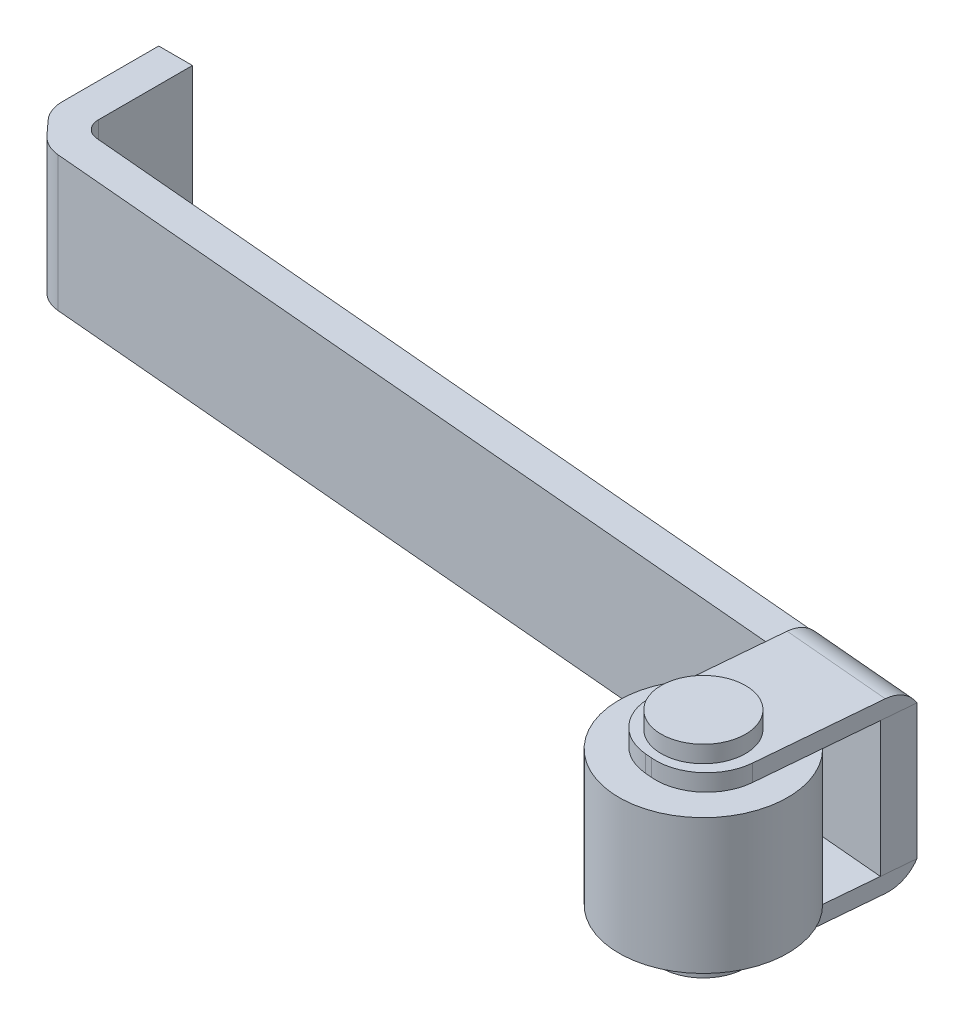
from build123d import *

# Parameters (mm, degrees)
SKETCH1_W                  = 1
SKETCH1_H                  = 4
BOSS_EXTRUDE1_DEPTH        = 4.25
CHAMFER1_SIZE              = 1
CHAMFER1_SIZE2             = 0.087488664
SKETCH2_W                  = 1.003819838
SKETCH2_H                  = 4
BOSS_EXTRUDE2_DEPTH        = 27.2
CHAMFER2_START             = -4
CHAMFER2_OUTLINE_W         = 4
CHAMFER2_OUTLINE_H         = 7
CHAMFER2_DEPTH             = 1.801741323
FILLET2_R                  = 0.5
FILLET3_R                  = 1
BOSS_EXTRUDE3_DEPTH        = 5
BOSS_EXTRUDE3_DEPTH_BACK   = 1
SKETCH3_W                  = 3.2
SKETCH3_H                  = 0.5
BOSS_EXTRUDE3_2_DEPTH      = 5
BOSS_EXTRUDE3_2_DEPTH_BACK = 1
FILLET5_R                  = 1
FILLET6_R                  = 1
FILLET9_R                  = 1.5
FILLET10_R                 = 1.5
BOSS_EXTRUDE4_DEPTH        = 0.5
BOSS_EXTRUDE4_DEPTH_BACK   = 5.5
SKETCH5_R                  = 1.25
SKETCH6_R                  = 2.5
BOSS_EXTRUDE5_DEPTH        = 4


with BuildPart() as part:
    # Sketch1 → Boss-Extrude1 (new body)
    with BuildSketch(Plane.XY):
        with Locations((0.5, 4.75)):
            Rectangle(SKETCH1_W, SKETCH1_H)
    extrude(amount=BOSS_EXTRUDE1_DEPTH)

    # Chamfer1
    chamfer1_edges = [part.edges().sort_by_distance(p)[0] for p in [
        (1, 4.75, 4.25),
    ]]
    chamfer1_side = [part.faces().sort_by_distance(p)[0] for p in [
        (1, 4.75, 2.125),
    ]]
    chamfer(chamfer1_edges, length=CHAMFER1_SIZE, length2=CHAMFER1_SIZE2, reference=chamfer1_side[0])

    # Sketch2 → Boss-Extrude2 (add)
    with BuildSketch(Plane(origin=(1.274582165, 0, 0.11151149), x_dir=(0.08715574274765592, 0, -0.9961946980917458), z_dir=(0.9961946980917459, 0, 0.08715574274765593))):
        with Locations((-3.652386945, 4.75)):
            Rectangle(SKETCH2_W, SKETCH2_H)
    extrude(amount=BOSS_EXTRUDE2_DEPTH)

    # Chamfer2: read off the stored shape, not the designer's step
    # Chamfer2 outline → Chamfer2 (cut)
    with BuildSketch(Plane(origin=(0, 0, 0), x_dir=(0.6755902076156571, 0, 0.737277336810127), z_dir=(0.737277336810127, 0, -0.675590207615657)).offset(CHAMFER2_START)):
        with Locations((3, -4.5)):
            Rectangle(CHAMFER2_OUTLINE_W, CHAMFER2_OUTLINE_H)
    extrude(amount=CHAMFER2_DEPTH, mode=Mode.SUBTRACT)

    # Fillet2
    fillet2_edges = [part.edges().sort_by_distance(p)[0] for p in [
        (1, 4.75, 3.25),
    ]]
    fillet(fillet2_edges, radius=FILLET2_R)

    # Fillet3
    fillet3_edges = [part.edges().sort_by_distance(p)[0] for p in [
        (0, 4.75, 3.253834428),
        (0.912844258, 4.75, 4.250029127),
    ]]
    fillet(fillet3_edges, radius=FILLET3_R)


with BuildPart() as body_2:
    # Sketch3 → Boss-Extrude3 (new, two sides: drawn at the far end of the back side and taken through both)
    with BuildSketch(Plane(origin=(-0.362070829, 0, 4.13848851), x_dir=(0.9961946980917458, 0, 0.08715574274765595), z_dir=(-0.08715574274765596, 0, 0.9961946980917459)).offset(-BOSS_EXTRUDE3_DEPTH_BACK)):
        with Locations((26.879450862, 7)):
            Rectangle(SKETCH3_W, SKETCH3_H)
    extrude(amount=BOSS_EXTRUDE3_DEPTH + BOSS_EXTRUDE3_DEPTH_BACK)

    # Fillet5
    # the kernel refuses this fillet: 1 mm, written as the material it takes off along each edge
    with BuildSketch(Plane(origin=(22.751515044, 7.25, 5.15684541), x_dir=(-0.08715574274765596, 0, 0.9961946980917458), z_dir=(0.9961946980917459, 0, 0.08715574274765596))) as fillet5_piece_1:
        with BuildLine():
            CenterArc((0.866025404, 1), FILLET5_R, 210, 60)
            Line((0, 0.5), (-0.017320508, 0.49))
            ThreePointArc((-0.017320508, 0.49), (-0.02, 0.25), (-0.02, 0))
            Line((-0.02, 0), (0, -0.02))
            Line((0, -0.02), (0.866025404, -0.02))
            Line((0.866025404, -0.02), (0.866025404, 0))
        make_face()
    extrude(amount=7.530127019, mode=Mode.SUBTRACT)

    # Fillet10
    fillet10_edges = [body_2.edges().sort_by_distance(p)[0] for p in [
        (27.573228411, 7, 11.601609693),
        (24.385405377, 7, 11.322711316),
    ]]
    fillet(fillet10_edges, radius=FILLET10_R)



with BuildPart() as body_3:
    # Sketch3 → Boss-Extrude3 2 (new, two sides: drawn at the far end of the back side and taken through both)
    with BuildSketch(Plane(origin=(-0.362070829, 0, 4.13848851), x_dir=(0.9961946980917458, 0, 0.08715574274765595), z_dir=(-0.08715574274765596, 0, 0.9961946980917459)).offset(-BOSS_EXTRUDE3_2_DEPTH_BACK)):
        with Locations((26.879450862, 2.5)):
            Rectangle(SKETCH3_W, SKETCH3_H)
    extrude(amount=BOSS_EXTRUDE3_2_DEPTH + BOSS_EXTRUDE3_2_DEPTH_BACK)

    # Fillet6
    # the kernel refuses this fillet: 1 mm, written as the material it takes off along each edge
    with BuildSketch(Plane(origin=(22.751515044, 2.25, 5.15684541), x_dir=(0, 1, 0), z_dir=(0.9961946980917459, 0, 0.08715574274765596))) as fillet6_piece_1:
        with BuildLine():
            CenterArc((1, 0.866025404), FILLET6_R, 180, 60)
            Line((0, 0.866025404), (-0.02, 0.866025404))
            Line((-0.02, 0.866025404), (-0.02, 0))
            Line((-0.02, 0), (0, -0.02))
            ThreePointArc((0, -0.02), (0.25, -0.02), (0.49, -0.017320508))
            Line((0.49, -0.017320508), (0.5, 0))
        make_face()
    extrude(amount=7.530127019, mode=Mode.SUBTRACT)

    # Fillet9
    fillet9_edges = [body_3.edges().sort_by_distance(p)[0] for p in [
        (27.573228411, 2.5, 11.601609693),
        (24.385405377, 2.5, 11.322711316),
    ]]
    fillet(fillet9_edges, radius=FILLET9_R)


with BuildPart() as body_2_1:
    add(body_2.part)

    add(body_3.part)  # Boss-Extrude4 merges body 3
    # Sketch5 → Boss-Extrude4 (add, two sides: drawn at the far end of the back side and taken through both)
    with BuildSketch(Plane.XZ.offset(-2.25).offset(-BOSS_EXTRUDE4_DEPTH_BACK)):
        with Locations(Location((26.110050508, 9.967868458, 0), (0, 0, 180))):
            Circle(SKETCH5_R)
    extrude(amount=BOSS_EXTRUDE4_DEPTH + BOSS_EXTRUDE4_DEPTH_BACK)

    # Sketch6 → Boss-Extrude5 (add)
    with BuildSketch(Plane(origin=(0, 2.75, 0), x_dir=(1, 0, 0), z_dir=(0, 1, 0))):
        with Locations(Location((26.110050508, -9.967868458, 0), (0, 0, 45.2081805))):
            Circle(SKETCH6_R)
    extrude(amount=BOSS_EXTRUDE5_DEPTH)


solid = Compound([part.part, body_2_1.part])
